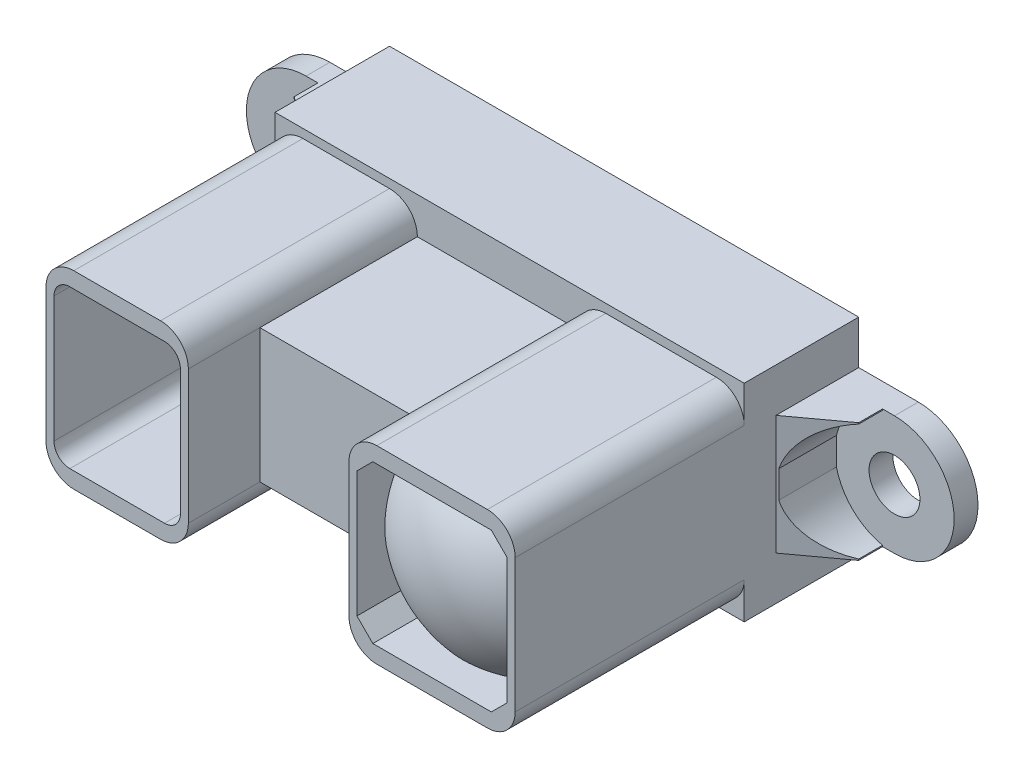
from build123d import *

# Parameters (mm, degrees)
SKETCH1_R           = 1.6
BOSS_EXTRUDE1_DEPTH = 7.2
CUT_EXTRUDE1_DEPTH  = 46.901288027
CUT_EXTRUDE2_DEPTH  = 45.728108035
BOSS_EXTRUDE4_DEPTH = 14.4
SKETCH6_W           = 10.1
SKETCH6_H           = 8.4
BOSS_EXTRUDE5_DEPTH = 9.9
REVOLVE1_ANGLE      = 180
CUT_EXTRUDE3_DEPTH  = 4


with BuildPart() as part:
    # Sketch1 → Boss-Extrude1 (new body)
    with BuildSketch(Plane.XY):
        with BuildLine():
            Line((-39.67911745, 6.306787833), (-35.92911745, 6.306787833))
            Line((-35.92911745, 6.306787833), (-35.92911745, 9.056787833))
            Line((-35.92911745, 9.056787833), (-6.42911745, 9.056787833))
            Line((-6.42911745, 9.056787833), (-6.42911745, 6.306787833))
            Line((-6.42911745, 6.306787833), (-2.67911745, 6.306787833))
            ThreePointArc((-2.67911745, 6.306787833), (1.07088255, 2.556787833), (-2.67911745, -1.193212167))
            Line((-2.67911745, -1.193212167), (-6.42911745, -1.193212167))
            Line((-6.42911745, -1.193212167), (-6.42911745, -3.943212167))
            Line((-6.42911745, -3.943212167), (-16.12911745, -3.943212167))
            Line((-16.12911745, -3.943212167), (-16.12911745, -3.079352829))
            ThreePointArc((-16.12911745, -3.079352829), (-16.680326656, -2.453304755), (-16.87911745, -1.643212167))
            Line((-16.87911745, -1.643212167), (-25.47911745, -1.643212167))
            ThreePointArc((-25.47911745, -1.643212167), (-25.677908244, -2.453304755), (-26.22911745, -3.079352829))
            Line((-26.22911745, -3.079352829), (-26.22911745, -3.943212167))
            Line((-26.22911745, -3.943212167), (-35.92911745, -3.943212167))
            Line((-35.92911745, -3.943212167), (-35.92911745, -1.193212167))
            Line((-35.92911745, -1.193212167), (-39.67911745, -1.193212167))
            ThreePointArc((-39.67911745, -1.193212167), (-43.42911745, 2.556787833), (-39.67911745, 6.306787833))
        make_face()
        with Locations((-39.67911745, 2.556787833)):
            Circle(SKETCH1_R, mode=Mode.SUBTRACT)
        with Locations((-2.67911745, 2.556787833)):
            Circle(SKETCH1_R, mode=Mode.SUBTRACT)
    extrude(amount=BOSS_EXTRUDE1_DEPTH)

    # Sketch3 → Cut-Extrude1 (cut, through all)
    with BuildSketch(Plane.XZ.offset(3.943212167)):
        Polygon((-44.543539252, 1.5), (-38.92911745, 1.5), (-38.92911745, 3), (-35.92911745, 5.2), (-35.92911745, 8.378943839), (-44.543539252, 8.378943839), align=None)
        Polygon((2.185304351, 8.378943839), (2.185304351, 1.5), (-3.42911745, 1.5), (-3.42911745, 3), (-6.42911745, 5.2), (-6.42911745, 8.378943839), align=None)
    extrude(amount=-CUT_EXTRUDE1_DEPTH, mode=Mode.SUBTRACT)

    # Sketch4 → Cut-Extrude2 (cut, through all)
    with BuildSketch(Plane.XY.offset(1.5)):
        with BuildLine():
            Line((-36.02911745, 3.417020359), (-36.02911745, 1.696555306))
            ThreePointArc((-36.02911745, 1.696555306), (-43.42911745, 2.556787833), (-36.02911745, 3.417020359))
        make_face()
        with BuildLine():
            Line((-6.32911745, 3.417020359), (-6.32911745, 1.696555306))
            ThreePointArc((-6.32911745, 1.696555306), (1.07088255, 2.556787833), (-6.32911745, 3.417020359))
        make_face()
    extrude(amount=CUT_EXTRUDE2_DEPTH, mode=Mode.SUBTRACT)

    # Sketch5 → Boss-Extrude4 (add)
    # profile 1 of 2: a face of its own
    with BuildSketch(Plane.XY.offset(7.2)):
        with BuildLine():
            Line((-34.17911745, 8.506787833), (-28.72911745, 8.506787833))
            ThreePointArc((-28.72911745, 8.506787833), (-27.491680583, 7.9942247), (-26.97911745, 6.756787833))
            Line((-26.97911745, 6.756787833), (-26.97911745, -1.643212167))
            ThreePointArc((-26.97911745, -1.643212167), (-27.491680583, -2.880649034), (-28.72911745, -3.393212167))
            Line((-28.72911745, -3.393212167), (-34.17911745, -3.393212167))
            ThreePointArc((-34.17911745, -3.393212167), (-35.416554317, -2.880649034), (-35.92911745, -1.643212167))
            Line((-35.92911745, -1.643212167), (-35.92911745, 6.756787833))
            ThreePointArc((-35.92911745, 6.756787833), (-35.416554317, 7.9942247), (-34.17911745, 8.506787833))
        make_face()
        with BuildLine():
            Line((-34.42911745, 7.506787833), (-28.47911745, 7.506787833))
            ThreePointArc((-28.47911745, 7.506787833), (-27.772010669, 7.213894614), (-27.47911745, 6.506787833))
            Line((-27.47911745, 6.506787833), (-27.47911745, -1.393212167))
            ThreePointArc((-27.47911745, -1.393212167), (-27.772010669, -2.100318948), (-28.47911745, -2.393212167))
            Line((-28.47911745, -2.393212167), (-34.42911745, -2.393212167))
            ThreePointArc((-34.42911745, -2.393212167), (-35.136224231, -2.100318948), (-35.42911745, -1.393212167))
            Line((-35.42911745, -1.393212167), (-35.42911745, 6.506787833))
            ThreePointArc((-35.42911745, 6.506787833), (-35.136224231, 7.213894614), (-34.42911745, 7.506787833))
        make_face(mode=Mode.SUBTRACT)
    # profile 2 of 2: a face of its own
    with BuildSketch(Plane.XY.offset(7.2)):
        with BuildLine():
            Line((-15.12911745, 8.506787833), (-8.17911745, 8.506787833))
            ThreePointArc((-8.17911745, 8.506787833), (-6.941680583, 7.9942247), (-6.42911745, 6.756787833))
            Line((-6.42911745, 6.756787833), (-6.42911745, -1.643212167))
            ThreePointArc((-6.42911745, -1.643212167), (-6.941680583, -2.880649034), (-8.17911745, -3.393212167))
            Line((-8.17911745, -3.393212167), (-15.12911745, -3.393212167))
            ThreePointArc((-15.12911745, -3.393212167), (-16.366554317, -2.880649034), (-16.87911745, -1.643212167))
            Line((-16.87911745, -1.643212167), (-16.87911745, 6.756787833))
            ThreePointArc((-16.87911745, 6.756787833), (-16.366554317, 7.9942247), (-15.12911745, 8.506787833))
        make_face()
        Polygon((-15.37911745, 7.506787833), (-7.92911745, 7.506787833), (-6.92911745, 6.506787833), (-6.92911745, -1.393212167), (-7.92911745, -2.393212167), (-15.37911745, -2.393212167), (-16.37911745, -1.393212167), (-16.37911745, 6.506787833), align=None, mode=Mode.SUBTRACT)
    extrude(amount=BOSS_EXTRUDE4_DEPTH)

    # Sketch6 → Boss-Extrude5 (add)
    with BuildSketch(Plane.XY.offset(7.2)):
        with Locations((-21.92911745, 2.556787833)):
            Rectangle(SKETCH6_W, SKETCH6_H)
    extrude(amount=BOSS_EXTRUDE5_DEPTH)

    # Sketch7 → Revolve1 (revolve)
    with BuildSketch(Plane.XY.offset(7.2)):
        with BuildLine():
            Line((-31.45411745, 6.527394978), (-31.45411745, -1.272605022))
            ThreePointArc((-31.45411745, -1.272605022), (-27.55411745, 2.627394978), (-31.45411745, 6.527394978))
        make_face()
    revolve(axis=Axis((-31.45411745, 8.506787833, 7.2), (0, -1, 0)), revolution_arc=REVOLVE1_ANGLE)

    # Sketch11 → Revolve7 (revolve)
    with BuildSketch(Plane(origin=(-11.65411745, 0, 0), x_dir=(0, 0, -1), z_dir=(1, 0, 0))):
        with BuildLine():
            Line((-17.85, 9.006787833), (-17.85, 2.556787833))
            Line((-17.85, 2.556787833), (-21.522794753, 2.556787833))
            ThreePointArc((-21.522794753, 2.556787833), (-20.54023441, 6.267984449), (-17.85, 9.006787833))
        make_face()
    revolve(axis=Axis((-11.65411745, 2.556787833, 6.48), (0, 0, 1)))

    # Sketch12 → Cut-Extrude3 (cut)
    with BuildSketch(Plane.XY.offset(21.6)):
        with BuildLine():
            Line((-9.164137531, 8.506787833), (-14.14409737, 8.506787833))
            ThreePointArc((-14.14409737, 8.506787833), (-11.65411745, 9.006787833), (-9.164137531, 8.506787833))
        make_face()
        with BuildLine():
            Line((-6.42911745, -1.224994155), (-6.42911745, 6.33856982))
            ThreePointArc((-6.42911745, 6.33856982), (-5.20411745, 2.556787833), (-6.42911745, -1.224994155))
        make_face()
        with BuildLine():
            Line((-14.14409737, -3.393212167), (-9.164137531, -3.393212167))
            ThreePointArc((-9.164137531, -3.393212167), (-11.65411745, -3.893212167), (-14.14409737, -3.393212167))
        make_face()
        with BuildLine():
            Line((-16.87911745, 6.33856982), (-16.87911745, -1.224994155))
            ThreePointArc((-16.87911745, -1.224994155), (-18.10411745, 2.556787833), (-16.87911745, 6.33856982))
        make_face()
    extrude(amount=-CUT_EXTRUDE3_DEPTH, mode=Mode.SUBTRACT)


solid = part.part
